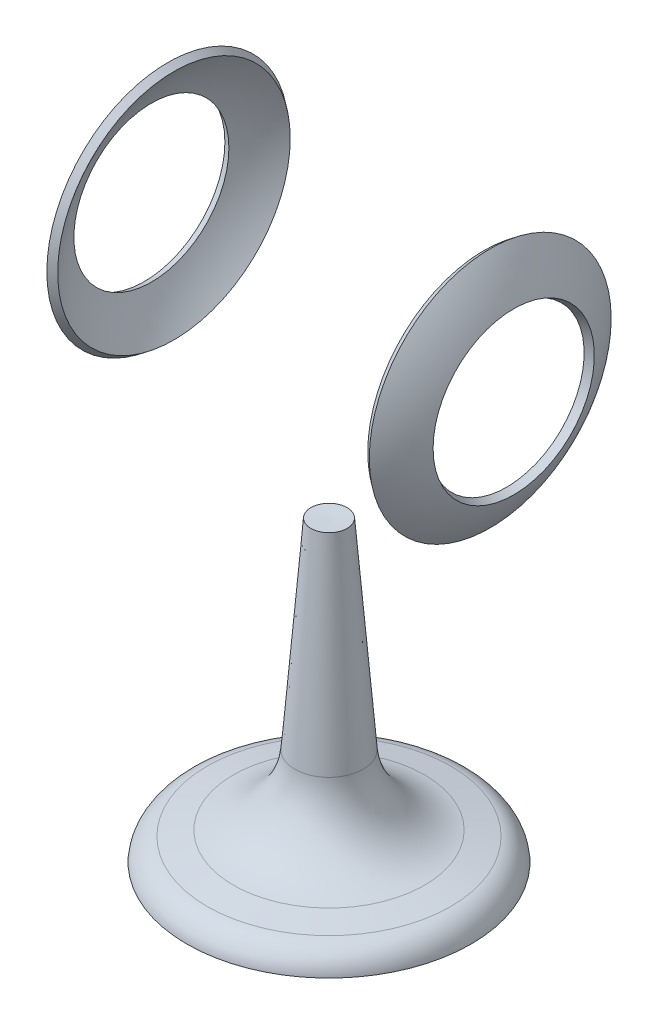
from build123d import *

# Parameters (mm, degrees)
FILLET2_R      = 30
THICKEN2_ANGLE = 180
SCALE7_SCALE   = 0.4


with BuildPart() as part:
    # Sketch3 → Revolve1 (revolve)
    with BuildSketch(Plane(origin=(0, 0, 0), x_dir=(0, 0, -1), z_dir=(1, 0, 0)), mode=Mode.PRIVATE) as revolve1_sk:
        Polygon((0, -75), (7, -74.67261881), (15, -174.67261881), (55, -183), (55, -190), (0, -190), align=None)
    revolve(revolve1_sk.sketch.rotate(Axis((0, 0, 0), (0, -1, 0)), 180), axis=Axis((0, 0, 0), (0, -1, 0)))

    # Fillet1: read off the stored shape, not the designer's step
    # Fillet1 outline → Fillet1 (revolve, cut)
    with BuildSketch(Plane.XY):
        with BuildLine():
            Line((55, -181.356187813), (47.104061772, -181.356187813))
            ThreePointArc((47.104061772, -181.356187813), (52.449170173, -184.401836942), (55, -190))
            Line((55, -190), (55, -181.356187813))
        make_face()
    revolve(axis=Axis((0, 0, 0), (0, 1, 0)), mode=Mode.SUBTRACT)

    # Fillet2
    fillet2_edges = [part.edges().sort_by_distance(p)[0] for p in [
        (0, -174.67261881, -15),
    ]]
    fillet(fillet2_edges, radius=FILLET2_R)


with BuildPart() as body_2:
    # Thicken1: read off the stored shape, not the designer's step
    # Thicken1 outline → Thicken1 (revolve)
    with BuildSketch(Plane.YX):
        with BuildLine():
            Line((46.800000062, -62.399999953), (45.00000006, -59.999999955))
            ThreePointArc((45.00000006, -59.999999955), (37.753687731, -64.804776543), (29.999999931, -68.738635454))
            Line((29.999999931, -68.738635454), (31.199999929, -71.488180873))
            ThreePointArc((31.199999929, -71.488180873), (39.26383524, -67.396967604), (46.800000062, -62.399999953))
        make_face()
    revolve(axis=Axis((0, 0, 0), (1, 0, 0)))


with BuildPart() as body_3:
    # Thicken2: read off the stored shape, not the designer's step
    # Thicken2: copy of body 2
    add(body_2.part.rotate(Axis((0, 0, 0), (0, 1, 0)), THICKEN2_ANGLE))


with BuildPart() as body_3_1:
    # Scale7: scaled about (0, 0, 0)
    add(body_3.part.scale(SCALE7_SCALE))


with BuildPart() as part_1:
    # Scale7: scaled about (0, 0, 0)
    add(part.part.scale(SCALE7_SCALE))


with BuildPart() as body_2_1:
    # Scale7: scaled about (0, 0, 0)
    add(body_2.part.scale(SCALE7_SCALE))


solid = Compound([body_3_1.part, part_1.part, body_2_1.part])
